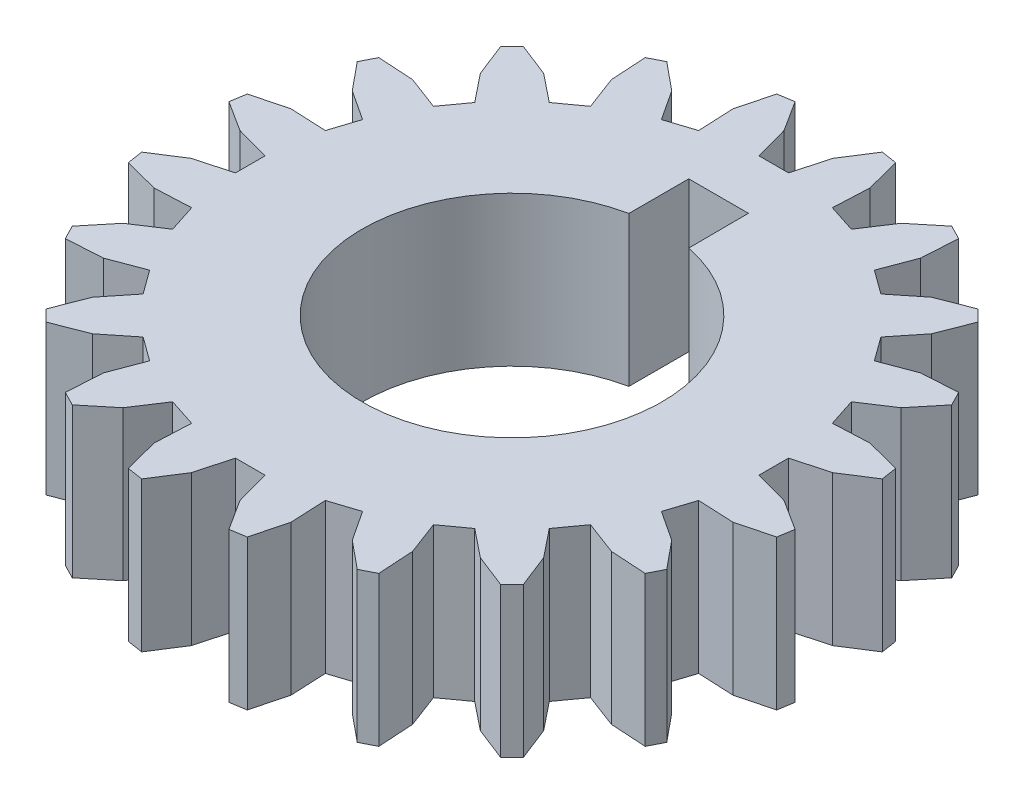
from build123d import *

# Parameters (mm, degrees)
EXTRUDE_1_DEPTH = 10


with BuildPart() as part:
    # 草图1 → 凸台-拉伸1 (new body)
    with BuildSketch(Plane(origin=(0, 0, 0), x_dir=(1, 0, 0), z_dir=(0, 1, 0))):
        Polygon((-14.683706419, 10.11909141), (-16.556988735, 11.617911306), (-18.790431592, 12.493913999), (-19.546224028, 11.738121563), (-18.670221336, 9.504678705), (-17.171401439, 7.631396389), (-18.330715675, 6.035737236), (-20.575473847, 6.882323594), (-22.97030395, 7.025279864), (-23.455552564, 6.072925836), (-21.932252696, 4.219495172), (-19.927914196, 2.901058638), (-20.537401758, 1.025248802), (-22.933903218, 1.13673185), (-25.25569791, 0.532648142), (-25.422903187, -0.52304443), (-23.401417348, -1.815036194), (-21.087758862, -2.449569192), (-21.087758862, -4.421912375), (-23.401417348, -5.056445373), (-25.422903187, -6.348437137), (-25.25569791, -7.404129709), (-22.933903218, -8.008213418), (-20.537401758, -7.896730369), (-19.927914196, -9.772540205), (-21.932252696, -11.090976739), (-23.455552564, -12.944407403), (-22.97030395, -13.896761431), (-20.575473847, -13.753805161), (-18.330715675, -12.907218803), (-17.171401439, -14.502877956), (-18.670221336, -16.376160272), (-19.546224028, -18.60960313), (-18.790431592, -19.365395566), (-16.556988735, -18.489392873), (-14.683706419, -16.990572977), (-13.088047265, -18.149887212), (-13.934633623, -20.394645385), (-14.077589894, -22.789475488), (-13.125235866, -23.274724102), (-11.271805201, -21.751424234), (-9.953368667, -19.747085734), (-8.077558831, -20.356573296), (-8.18904188, -22.753074756), (-7.584958172, -25.074869447), (-6.529265599, -25.242074725), (-5.237273835, -23.220588886), (-4.602740837, -20.906930399), (-2.630397654, -20.906930399), (-1.995864656, -23.220588886), (-0.703872892, -25.242074725), (0.35181968, -25.074869447), (0.955903388, -22.753074756), (0.844420339, -20.356573296), (2.720230176, -19.747085734), (4.03866671, -21.751424234), (5.892097374, -23.274724102), (6.844451402, -22.789475488), (6.701495132, -20.394645385), (5.854908774, -18.149887212), (7.450567927, -16.990572977), (9.323850243, -18.489392873), (11.557293101, -19.365395566), (12.313085537, -18.60960313), (11.437082844, -16.376160272), (9.938262948, -14.502877956), (11.097577183, -12.907218803), (13.342335356, -13.753805161), (15.737165459, -13.896761431), (16.222414073, -12.944407403), (14.699114205, -11.090976739), (12.694775705, -9.772540205), (13.304263267, -7.896730369), (15.700764727, -8.008213417), (18.022559418, -7.404129709), (18.189764695, -6.348437137), (16.168278856, -5.056445373), (13.85462037, -4.421912375), (13.85462037, -2.449569192), (16.168278856, -1.815036194), (18.189764695, -0.52304443), (18.022559418, 0.532648142), (15.700764727, 1.13673185), (13.304263267, 1.025248802), (12.694775705, 2.901058638), (14.699114205, 4.219495172), (16.222414073, 6.072925836), (15.737165459, 7.025279864), (13.342335356, 6.882323594), (11.097577183, 6.035737236), (9.938262948, 7.631396389), (11.437082844, 9.504678705), (12.313085537, 11.738121563), (11.557293101, 12.493913999), (9.323850243, 11.617911306), (7.450567927, 10.11909141), (5.854908774, 11.278405645), (6.701495132, 13.523163818), (6.844451402, 15.917993921), (5.892097374, 16.403242535), (4.03866671, 14.879942667), (2.720230176, 12.875604167), (0.844420339, 13.485091729), (0.955903388, 15.881593189), (0.35181968, 18.20338788), (-0.703872892, 18.370593158), (-1.995864656, 16.349107319), (-2.630397654, 14.035448832), (-4.602740837, 14.035448832), (-5.237273835, 16.349107319), (-6.529265599, 18.370593158), (-7.584958172, 18.20338788), (-8.18904188, 15.881593189), (-8.077558831, 13.485091729), (-9.953368667, 12.875604167), (-11.271805201, 14.879942667), (-13.125235866, 16.403242535), (-14.077589894, 15.917993921), (-13.934633623, 13.523163818), (-13.088047265, 11.278405645), align=None)
        with BuildLine():
            Line((-5.616569246, 6.362218188), (-5.616569246, 10.362218188))
            Line((-5.616569246, 10.362218188), (-1.635108206, 10.362218188))
            Line((-1.635108206, 10.362218188), (-1.616569246, 6.362218188))
            ThreePointArc((-1.616569246, 6.362218188), (-3.616569246, -13.435740784), (-5.616569246, 6.362218188))
        make_face(mode=Mode.SUBTRACT)
    extrude(amount=EXTRUDE_1_DEPTH)


solid = part.part
